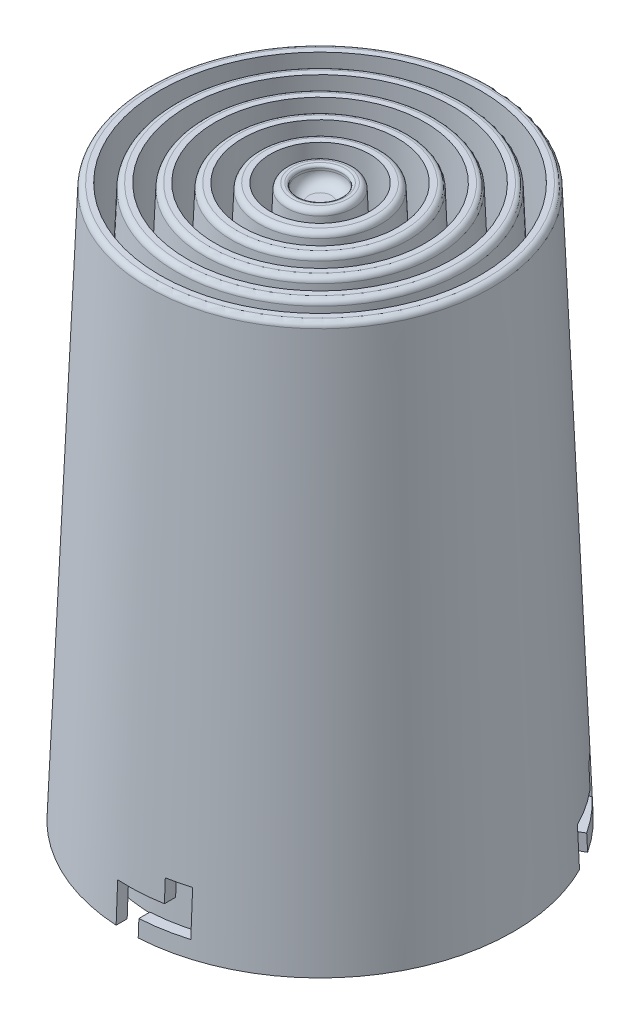
from build123d import *

# Parameters (mm, degrees)
CUT_EXTRUDE_START        = 30
CUT_EXTRUDE_2_DEPTH      = 6
PATTERN_CIRCULAR_1_COUNT = 3


with BuildPart() as part:
    # Эскиз6 → Повернуть1 (revolve)
    with BuildSketch(Plane.XY, mode=Mode.PRIVATE) as revolve_1_sk:
        with BuildLine():
            Line((-35, 0), (-31.038401278, 99.039968038))
            ThreePointArc((-31.038401278, 99.039968038), (-30.732032176, 99.721099174), (-30.03920032, 100))
            Line((-30.03920032, 100), (-29, 100))
            Line((-29, 100), (-33, 0))
            Line((-33, 0), (-35, 0))
        make_face()
        with BuildLine():
            Line((-24, 100), (-28, 0))
            Line((-28, 0), (-30, 0))
            Line((-30, 0), (-26.038401278, 99.039968038))
            ThreePointArc((-26.038401278, 99.039968038), (-25.732032176, 99.721099174), (-25.03920032, 100))
            Line((-25.03920032, 100), (-24, 100))
        make_face()
        with BuildLine():
            Line((-19, 100), (-23, 0))
            Line((-23, 0), (-25, 0))
            Line((-25, 0), (-21.038401278, 99.039968038))
            ThreePointArc((-21.038401278, 99.039968038), (-20.732032176, 99.721099174), (-20.03920032, 100))
            Line((-20.03920032, 100), (-19, 100))
        make_face()
        with BuildLine():
            Line((-14, 100), (-18, 0))
            Line((-18, 0), (-20, 0))
            Line((-20, 0), (-16.038401278, 99.039968038))
            ThreePointArc((-16.038401278, 99.039968038), (-15.732032176, 99.721099174), (-15.03920032, 100))
            Line((-15.03920032, 100), (-14, 100))
        make_face()
        with BuildLine():
            Line((-9, 100), (-13, 0))
            Line((-13, 0), (-15, 0))
            Line((-15, 0), (-11.038401278, 99.039968038))
            ThreePointArc((-11.038401278, 99.039968038), (-10.732032176, 99.721099174), (-10.03920032, 100))
            Line((-10.03920032, 100), (-9, 100))
        make_face()
        with BuildLine():
            Line((-4.020799361, 99.480015981), (-4.036802557, 99.079936077))
            ThreePointArc((-4.036802557, 99.079936077), (-3.480598988, 97.614336288), (-2.038400639, 97))
            Line((-2.038400639, 97), (0, 97))
            Line((0, 97), (0, 95))
            Line((0, 95), (-2.278400639, 95))
            ThreePointArc((-2.278400639, 95), (-3.664064352, 94.442198349), (-4.276802557, 93.079936077))
            Line((-4.276802557, 93.079936077), (-8, 0))
            Line((-8, 0), (-10, 0))
            Line((-10, 0), (-6.038401278, 99.039968038))
            ThreePointArc((-6.038401278, 99.039968038), (-5.732032176, 99.721099174), (-5.03920032, 100))
            Line((-5.03920032, 100), (-4.52039984, 100))
            ThreePointArc((-4.52039984, 100), (-4.159850253, 99.846415928), (-4.020799361, 99.480015981))
        make_face()
    revolve(revolve_1_sk.sketch.rotate(Axis((0, 0, 0), (0, 1, 0)), 180), axis=Axis((0, 0, 0), (0, 1, 0)))

    # Вырез-Вытянуть2: read off the stored shape, not the designer's step
    # Вырез-Вытянуть2 outline → Вырез-Вытянуть2 (cut)
    with BuildSketch(Plane.XY.offset(CUT_EXTRUDE_START)):
        Polygon((2, 0), (2, 3), (10, 3), (10, 11), (6, 11), (6, 7), (-2, 7), (-2, 0), align=None)
    cut_extrude_2 = extrude(amount=CUT_EXTRUDE_2_DEPTH, mode=Mode.SUBTRACT)

    # Круговой массив1: Вырез-Вытянуть2 ×3 about axis
    pattern_circular_1_axis = Axis((0, 0, 0), (0, 1, 0))
    for i in range(1, PATTERN_CIRCULAR_1_COUNT):
        add(cut_extrude_2.rotate(pattern_circular_1_axis, i * 360 / PATTERN_CIRCULAR_1_COUNT), mode=Mode.SUBTRACT)


solid = part.part
